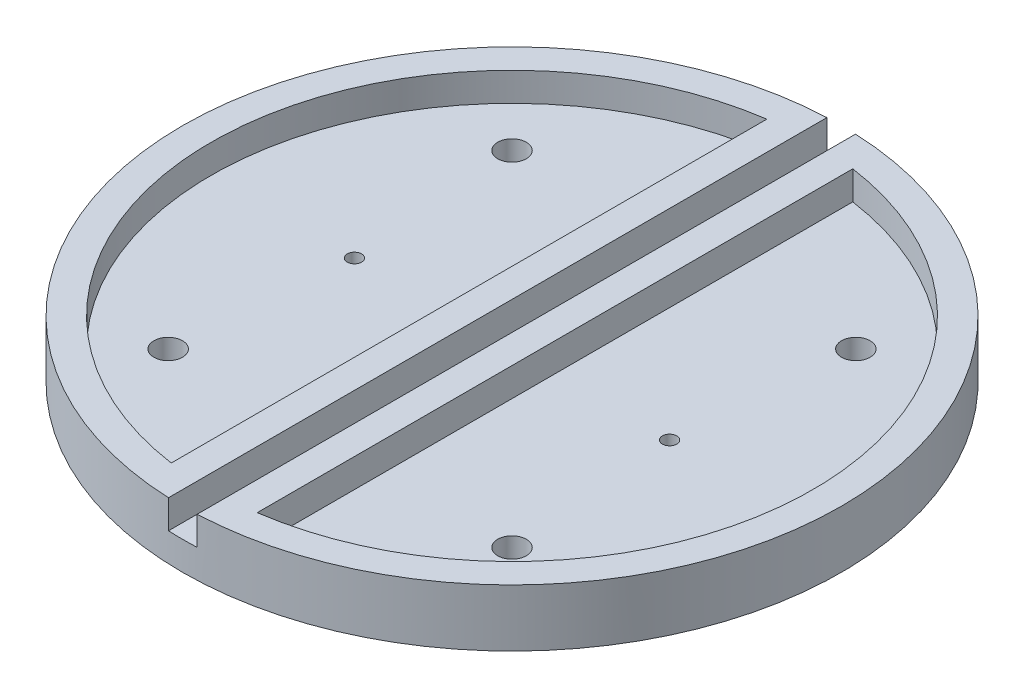
from build123d import *

# Parameters (mm, degrees)
SKETCH5_R           = 73.025
SKETCH5_R_2         = 3.175
PLATEBASE_DEPTH     = 6.35
PLATETOP_DEPTH      = 6.35
SKETCH9_R           = 73.025
SKETCH9_R_2         = 66.675
PLATEWALLS_DEPTH    = 6.35
TOPSLOTCUT_START    = -6.35
TOPSLOTCUT_DEPTH    = 6.35
BOTTOMSLOTCUT_START = -6.35
BOTTOMSLOTCUT_DEPTH = 6.35
SKETCH13_R          = 1.5875
RIGHTTHRUHOLE_DEPTH = 6.35
SKETCH14_R          = 1.5875
LEFTTHRUHOLE_DEPTH  = 6.35


with BuildPart() as part:
    # Sketch5 → PlateBase (new body)
    with BuildSketch(Plane(origin=(0, 0, 0), x_dir=(1, 0, 0), z_dir=(0, 1, 0))):
        Circle(SKETCH5_R)
        with Locations((38.1, 38.1)):
            Circle(SKETCH5_R_2, mode=Mode.SUBTRACT)
        with Locations((38.1, -38.1)):
            Circle(SKETCH5_R_2, mode=Mode.SUBTRACT)
        with Locations((-38.1, 38.1)):
            Circle(SKETCH5_R_2, mode=Mode.SUBTRACT)
        with Locations((-38.1, -38.1)):
            Circle(SKETCH5_R_2, mode=Mode.SUBTRACT)
    extrude(amount=PLATEBASE_DEPTH)

    # Sketch6 → PlateTop (add)
    with BuildSketch(Plane(origin=(0, 6.35, 0), x_dir=(1, 0, 0), z_dir=(0, 1, 0))):
        with BuildLine():
            Line((3.175, 72.955945611), (3.175, -72.955945611))
            ThreePointArc((3.175, -72.955945611), (6.35605636, -72.747860261), (9.525, -72.401139494))
            Line((9.525, -72.401139494), (9.525, 72.401139494))
            ThreePointArc((9.525, 72.401139494), (6.35605636, 72.747860261), (3.175, 72.955945611))
        make_face()
        with BuildLine():
            Line((-3.175, -72.955945611), (-3.175, 72.955945611))
            ThreePointArc((-3.175, 72.955945611), (-6.35605636, 72.747860261), (-9.525, 72.401139494))
            Line((-9.525, 72.401139494), (-9.525, -72.401139494))
            ThreePointArc((-9.525, -72.401139494), (-6.35605636, -72.747860261), (-3.175, -72.955945611))
        make_face()
    extrude(amount=PLATETOP_DEPTH)

    # Sketch9 → PlateWalls (add)
    with BuildSketch(Plane(origin=(0, 6.35, 0), x_dir=(1, 0, 0), z_dir=(0, 1, 0))):
        Circle(SKETCH9_R)
        Circle(SKETCH9_R_2, mode=Mode.SUBTRACT)
    extrude(amount=PLATEWALLS_DEPTH)

    # Sketch11 → TopSlotCut (cut)
    with BuildSketch(Plane(origin=(0, 12.7, 0), x_dir=(1, 0, 0), z_dir=(0, 1, 0)).offset(TOPSLOTCUT_START)):
        with BuildLine():
            Line((-3.175, 66.599361859), (-3.175, 72.955945611))
            ThreePointArc((-3.175, 72.955945611), (0, 73.025), (3.175, 72.955945611))
            Line((3.175, 72.955945611), (3.175, 66.599361859))
            Line((3.175, 66.599361859), (-3.175, 66.599361859))
        make_face()
    extrude(amount=TOPSLOTCUT_DEPTH, mode=Mode.SUBTRACT)

    # Sketch12 → BottomSlotCut (cut)
    with BuildSketch(Plane(origin=(0, 12.7, 0), x_dir=(1, 0, 0), z_dir=(0, 1, 0)).offset(BOTTOMSLOTCUT_START)):
        with BuildLine():
            Line((-3.175, -66.599361859), (-3.175, -72.955945611))
            ThreePointArc((-3.175, -72.955945611), (0, -73.025), (3.175, -72.955945611))
            Line((3.175, -72.955945611), (3.175, -66.599361859))
            Line((3.175, -66.599361859), (-3.175, -66.599361859))
        make_face()
    extrude(amount=BOTTOMSLOTCUT_DEPTH, mode=Mode.SUBTRACT)

    # Sketch13 → RightThruHole (cut)
    with BuildSketch(Plane(origin=(0, 6.35, 0), x_dir=(1, 0, 0), z_dir=(0, 1, 0))):
        with Locations((34.925, 0)):
            Circle(SKETCH13_R)
    extrude(amount=-RIGHTTHRUHOLE_DEPTH, mode=Mode.SUBTRACT)

    # Sketch14 → LeftThruHole (cut)
    with BuildSketch(Plane(origin=(0, 6.35, 0), x_dir=(1, 0, 0), z_dir=(0, 1, 0))):
        with Locations((-34.925, 0)):
            Circle(SKETCH14_R)
    extrude(amount=-LEFTTHRUHOLE_DEPTH, mode=Mode.SUBTRACT)


solid = part.part
